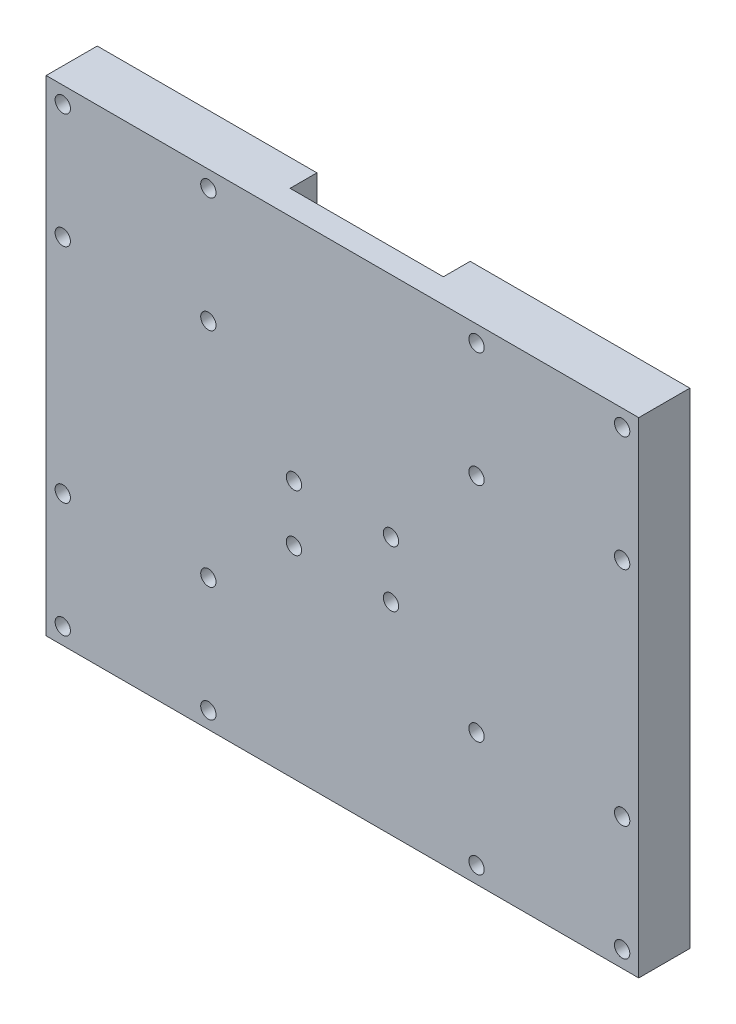
from build123d import *

# Parameters (mm, degrees)
SCHIZZO1_W                   = 232
SCHIZZO1_H                   = 190
ESTRUSIONE_ESTRUSIONE1_DEPTH = 20
SCHIZZO3_R                   = 3
TAGLIO_ESTRUSIONE1_DEPTH     = 152.26466871
SCHIZZO4_W                   = 60
SCHIZZO4_H                   = 10.5
TAGLIO_ESTRUSIONE2_DEPTH     = 224.508389104


with BuildPart() as part:
    # Schizzo1 → Estrusione-Estrusione1 (new body)
    with BuildSketch(Plane.XY):
        Rectangle(SCHIZZO1_W, SCHIZZO1_H)
    extrude(amount=ESTRUSIONE_ESTRUSIONE1_DEPTH)

    # Schizzo3 → Taglio-Estrusione1 (cut, through all)
    with BuildSketch(Plane.XY.offset(20)):
        with Locations((19, 6)):
            Circle(SCHIZZO3_R)
        with Locations((-19, 6)):
            Circle(SCHIZZO3_R)
        with Locations((-19, -16)):
            Circle(SCHIZZO3_R)
        with Locations((19, -16)):
            Circle(SCHIZZO3_R)
        with Locations((-109.5, 88.5)):
            Circle(SCHIZZO3_R)
        with Locations((-52.5, 88.5)):
            Circle(SCHIZZO3_R)
        with Locations((-109.5, 43.5)):
            Circle(SCHIZZO3_R)
        with Locations((-52.5, 43.5)):
            Circle(SCHIZZO3_R)
        with Locations((-109.5, -88.5)):
            Circle(SCHIZZO3_R)
        with Locations((-109.5, -43.5)):
            Circle(SCHIZZO3_R)
        with Locations((-52.5, -88.5)):
            Circle(SCHIZZO3_R)
        with Locations((-52.5, -43.5)):
            Circle(SCHIZZO3_R)
    taglio_estrusione1 = extrude(amount=-TAGLIO_ESTRUSIONE1_DEPTH, mode=Mode.SUBTRACT)

    # Schizzo4 → Taglio-Estrusione2 (cut, through all)
    with BuildSketch(Plane(origin=(0, 95, 0), x_dir=(1, 0, 0), z_dir=(0, 1, 0))):
        with Locations((0, -5.25)):
            Rectangle(SCHIZZO4_W, SCHIZZO4_H)
    extrude(amount=-TAGLIO_ESTRUSIONE2_DEPTH, mode=Mode.SUBTRACT)

    # Specchia1: Taglio-Estrusione1 across plane
    add(taglio_estrusione1.mirror(Plane(origin=(0, 0, 0), x_dir=(0, 0, 1), z_dir=(1, 0, 0))), mode=Mode.SUBTRACT)


solid = part.part
